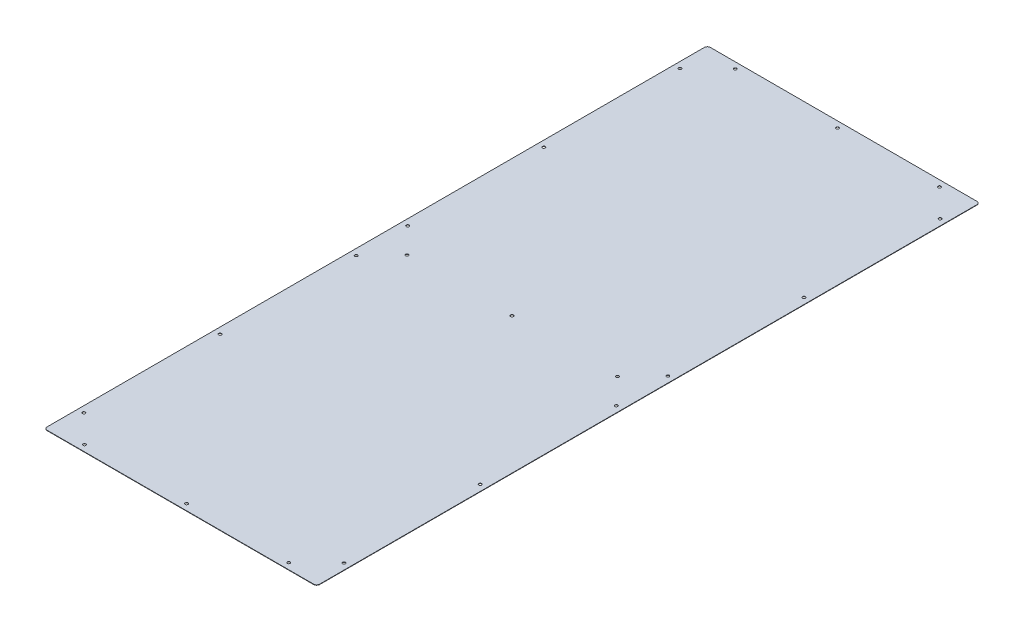
from build123d import *

# Parameters (mm, degrees)
SKETCH1_W                  = 559.1048
SKETCH1_H                  = 1360.7288
BOSS_EXTRUDE1_DEPTH        = 0.79375
FILLET1_R                  = 6.35
F_1_0_228_DIAMETER_HOLE1_D = 5.7912


with BuildPart() as part:
    # Sketch1 → Boss-Extrude1 (new body)
    with BuildSketch(Plane(origin=(0, 0, 0), x_dir=(1, 0, 0), z_dir=(0, 1, 0))):
        Rectangle(SKETCH1_W, SKETCH1_H)
    extrude(amount=BOSS_EXTRUDE1_DEPTH)

    # Fillet1
    fillet1_edges = [part.edges().sort_by_distance(p)[0] for p in [
        (-279.5524, 0.396875, -680.3644),
        (279.5524, 0.396875, -680.3644),
        (-279.5524, 0.396875, 680.3644),
        (279.5524, 0.396875, 680.3644),
    ]]
    fillet(fillet1_edges, radius=FILLET1_R)

    # #1 (0.228) Diameter Hole1 (through all)
    with Locations(Plane(origin=(0, 0, 0), x_dir=(-1, 0, 0), z_dir=(0, -1, 0))):
        with Locations((-266.8524, -611.632), (-209.55, -667.6644), (-266.8524, -332.232), (0, -667.6644), (209.55, -667.6644), (266.8524, -611.632), (266.8524, -332.232), (0, 0), (215.7476, 0.1524), (266.8524, -52.832), (266.8524, 52.832), (-266.8524, -52.832), (-266.8524, 52.832), (-216.0524, 0.1524), (-266.8524, 332.232), (-266.8524, 611.632), (-209.55, 667.6644), (0, 667.6644), (266.8524, 332.232), (266.8524, 611.632), (209.55, 667.6644)):
            Hole(F_1_0_228_DIAMETER_HOLE1_D / 2)


solid = part.part
